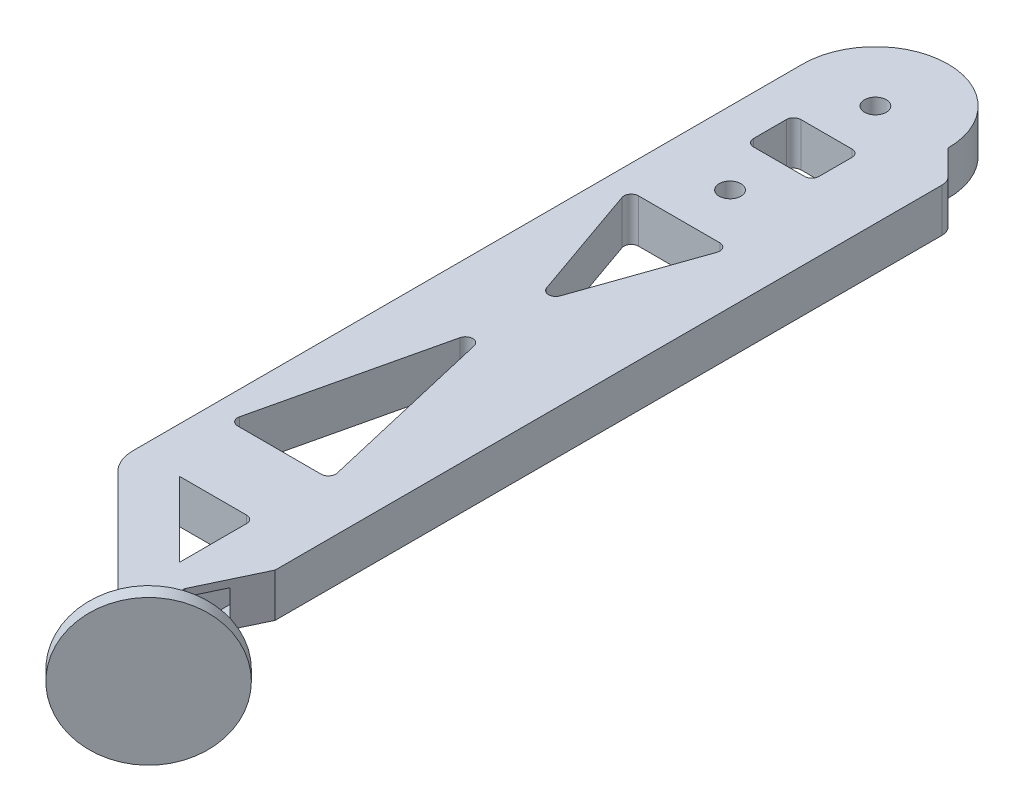
from build123d import *

# Parameters (mm, degrees)
SKETCH1_R               = 1.5
BOSS_EXTRUDE1_DEPTH     = 6
SKETCH3_W               = 13
SKETCH3_H               = 23
SKETCH3_W_2             = 9.027129354
SKETCH3_H_2             = 6.528275522
CUT_EXTRUDE1_DEPTH      = 14
FILLET1_R               = 1
BOSS_EXTRUDE4_DEPTH     = 120
SKETCH7_W               = 4
SKETCH7_H               = 6
CUT_EXTRUDE5_DEPTH      = 15
SKETCH8_R               = 10
BOSS_EXTRUDE5_DEPTH     = 2
CUT_EXTRUDE6_DEPTH      = 18
FILLET4_R               = 2
FILLET5_R               = 5
CUT_EXTRUDE8_DEPTH      = 20
CUT_EXTRUDE8_DEPTH_BACK = 20
CUT_EXTRUDE9_DEPTH      = 20
CUT_EXTRUDE9_DEPTH_BACK = 20
BOSS_EXTRUDE9_DEPTH     = 6
SKETCH16_R              = 10
BOSS_EXTRUDE10_DEPTH    = 2
FILLET6_R               = 5


with BuildPart() as part:
    # Sketch1 → Boss-Extrude1 (new body)
    with BuildSketch(Plane(origin=(0, 0, 0), x_dir=(1, 0, 0), z_dir=(0, 1, 0))):
        with BuildLine():
            Line((-10, 20), (-10, -100))
            Line((-10, -100), (10, -100))
            Line((10, -100), (10, 20))
            ThreePointArc((10, 20), (0, 30), (-10, 20))
        make_face()
        with Locations(Location((0, 0, 0), (0, 0, 270))):
            Circle(SKETCH1_R, mode=Mode.SUBTRACT)
        with Locations(Location((0, 20, 0), (0, 0, 270))):
            Circle(SKETCH1_R, mode=Mode.SUBTRACT)
    extrude(amount=BOSS_EXTRUDE1_DEPTH)

    # Sketch3 → Cut-Extrude1 (cut)
    with BuildSketch(Plane(origin=(0, 6, 0), x_dir=(1, 0, 0), z_dir=(0, 1, 0))):
        Polygon((7, -7), (-7, -7), (0, -27), align=None)
        Polygon((7, -62), (-7, -62), (0, -32), align=None)
        with Locations((0, -83.5)):
            Rectangle(SKETCH3_W, SKETCH3_H)
        with Locations((0, 10)):
            Rectangle(SKETCH3_W_2, SKETCH3_H_2)
    extrude(amount=-CUT_EXTRUDE1_DEPTH, mode=Mode.SUBTRACT)

    # Fillet1
    fillet1_edges = [part.edges().sort_by_distance(p)[0] for p in [
        (-6.5, 3, 95),
        (-6.5, 3, 72),
        (6.5, 3, 72),
        (6.5, 3, 95),
        (0, 3, 32),
        (7, 3, 62),
        (-7, 3, 62),
        (-7, 3, 7),
        (7, 3, 7),
        (0, 3, 27),
        (-4.513564677, 3, -13.264137761),
        (4.513564677, 3, -13.264137761),
        (4.513564677, 3, -6.735862239),
        (-4.513564677, 3, -6.735862239),
    ]]
    fillet(fillet1_edges, radius=FILLET1_R)

    # Sketch6 → Boss-Extrude4 (add)
    with BuildSketch(Plane.XY.offset(100)):
        Polygon((14, 6), (10, 6), (10, 5), (12, 5), (12, 1), (10, 1), (10, 0), (14, 0), align=None)
    extrude(amount=-BOSS_EXTRUDE4_DEPTH)

    # Sketch7 → Cut-Extrude5 (cut)
    with BuildSketch(Plane.XY.offset(100)):
        with Locations((12, 3)):
            Rectangle(SKETCH7_W, SKETCH7_H)
    extrude(amount=-CUT_EXTRUDE5_DEPTH, mode=Mode.SUBTRACT)

    # Sketch8 → Boss-Extrude5 (add)
    with BuildSketch(Plane.XY.offset(100)):
        with Locations((0, 3)):
            Circle(SKETCH8_R)
    extrude(amount=BOSS_EXTRUDE5_DEPTH)

    # Sketch9 → Cut-Extrude6 (cut)
    with BuildSketch(Plane(origin=(0, 6, 0), x_dir=(1, 0, 0), z_dir=(0, 1, 0))):
        Polygon((10, 20), (14, 16), (14, 20), align=None)
        Polygon((10, -85), (14, -76.582524272), (14, -85), align=None)
    extrude(amount=-CUT_EXTRUDE6_DEPTH, mode=Mode.SUBTRACT)

    # Fillet4
    fillet4_edges = [part.edges().sort_by_distance(p)[0] for p in [
        (14, 3, -16),
    ]]
    fillet(fillet4_edges, radius=FILLET4_R)

    # Fillet5
    # the kernel refuses this fillet: 5 mm, written as the material it adds along each edge
    with BuildSketch(Plane(origin=(22.039392014, 6, 100), x_dir=(0, 0, -1), z_dir=(-1, 0, 0))) as fillet5_piece_1_section:
        with BuildLine():
            CenterArc((FILLET5_R, -FILLET5_R), FILLET5_R, 90, 90)
            Line((0, -FILLET5_R), (0, 0))
            Line((0, 0), (FILLET5_R, 0))
        make_face()
    fillet5_piece_1 = extrude(amount=44.078784028, mode=Mode.PRIVATE)
    fillet5_piece_1 = fillet5_piece_1 & Plane(origin=(0, 3, 98.854598336), x_dir=(1, 0, 0), z_dir=(0, 0, -1)) * Cylinder(10, 109, mode=Mode.PRIVATE)
    add(fillet5_piece_1)
    with BuildSketch(Plane(origin=(22.039392014, 0, 100), x_dir=(0, 0, -1), z_dir=(-1, 0, 0))) as fillet5_piece_2_section:
        with BuildLine():
            CenterArc((FILLET5_R, FILLET5_R), FILLET5_R, 180, 90)
            Line((0, FILLET5_R), (0, 0))
            Line((0, 0), (FILLET5_R, 0))
        make_face()
    fillet5_piece_2 = extrude(amount=44.078784028, mode=Mode.PRIVATE)
    fillet5_piece_2 = fillet5_piece_2 & Plane(origin=(0, 3, 98.854598336), x_dir=(1, 0, 0), z_dir=(0, 0, -1)) * Cylinder(10, 109, mode=Mode.PRIVATE)
    add(fillet5_piece_2)

    # Sketch13 → Cut-Extrude8 (cut, two sides: drawn at the far end of the back side and taken through both)
    with BuildSketch(Plane.XZ.offset(-CUT_EXTRUDE8_DEPTH_BACK)):
        with BuildLine():
            Line((-6.5, 73.5), (0, 80))
            Line((0, 80), (6.5, 86.5))
            Line((6.5, 86.5), (6.5, 94))
            ThreePointArc((6.5, 94), (6.207106781, 94.707106781), (5.5, 95))
            Line((5.5, 95), (9.539392014, 95))
            Line((9.539392014, 95), (9.539392014, 100))
            Line((9.539392014, 100), (10, 100))
            Line((10, 100), (10, 90))
            Line((10, 90), (14.142135624, 94.142135624))
            Line((14.142135624, 94.142135624), (18.212490394, 115.492902619))
            Line((18.212490394, 115.492902619), (-15.568958515, 115.492902619))
            Line((-15.568958515, 115.492902619), (-15.568958515, 64.431041485))
            Line((-15.568958515, 64.431041485), (-10, 70))
            Line((-10, 70), (-10, 100))
            Line((-10, 100), (-9.539392014, 100))
            Line((-9.539392014, 100), (-9.539392014, 95))
            Line((-9.539392014, 95), (-5.5, 95))
            ThreePointArc((-5.5, 95), (-6.207106781, 94.707106781), (-6.5, 94))
            Line((-6.5, 94), (-6.5, 73.5))
        make_face()
    extrude(amount=CUT_EXTRUDE8_DEPTH + CUT_EXTRUDE8_DEPTH_BACK, mode=Mode.SUBTRACT)

    # Sketch14 → Cut-Extrude9 (cut, two sides: drawn at the far end of the back side and taken through both)
    with BuildSketch(Plane.XZ.offset(-CUT_EXTRUDE9_DEPTH_BACK)):
        Polygon((0, 80), (19.360707344, 99.360707344), (19.360707344, 111.570074628), (-16.85715032, 110.200384013), (-16.85715032, 63.14284968), align=None)
    extrude(amount=CUT_EXTRUDE9_DEPTH + CUT_EXTRUDE9_DEPTH_BACK, mode=Mode.SUBTRACT)

    # Sketch15 → Boss-Extrude9 (add)
    with BuildSketch(Plane.XZ):
        Polygon((14.142135624, 94.142135624), (16.263884736, 92.020386512), (10, 85.756501776), (-10, 65.756501776), (-10, 74.242640687), (12.02081528, 96.263455967), align=None)
    extrude(amount=-BOSS_EXTRUDE9_DEPTH)

    # Sketch16 → Boss-Extrude10 (add)
    with BuildSketch(Plane(origin=(54.142135624, 0, 54.142135624), x_dir=(0.7071067811865469, 0, -0.7071067811865481), z_dir=(0.7071067811865481, 0, 0.7071067811865469))):
        with Locations((-56.56823931, 3)):
            Circle(SKETCH16_R)
    extrude(amount=BOSS_EXTRUDE10_DEPTH)

    # Fillet6
    fillet6_edges = [part.edges().sort_by_distance(p)[0] for p in [
        (-10, 3, 74.242640687),
    ]]
    fillet(fillet6_edges, radius=FILLET6_R)


solid = part.part
